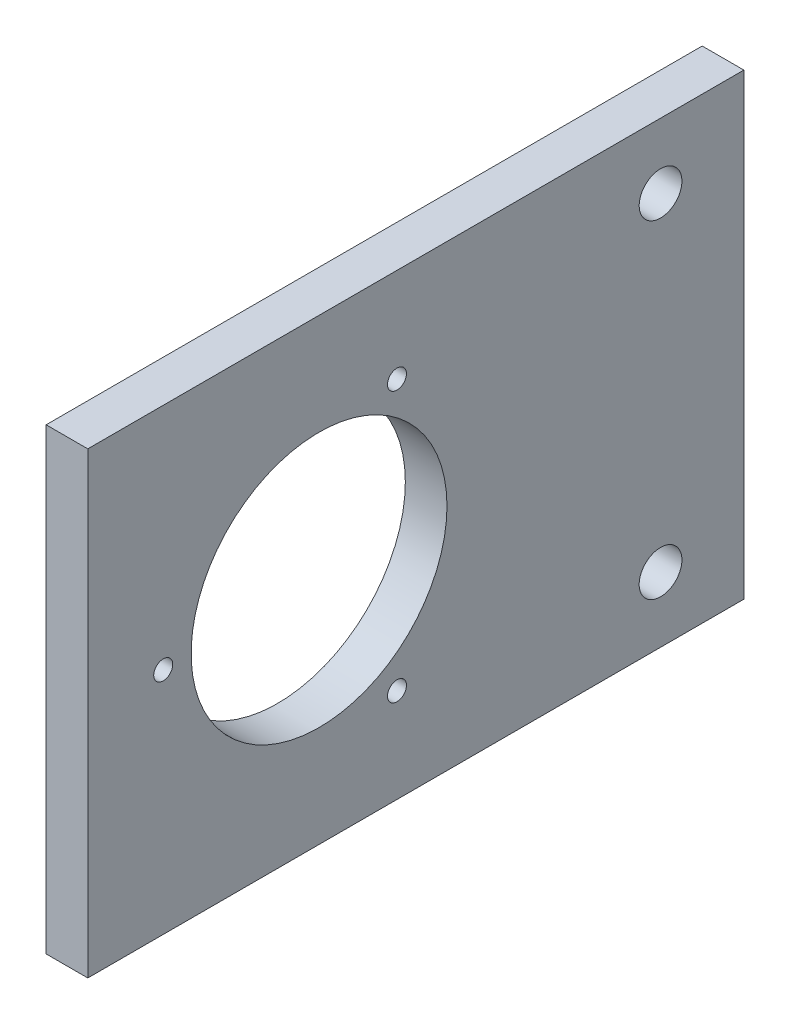
from build123d import *

# Parameters (mm, degrees)
SKETCH1_W           = 69.85
SKETCH1_H           = 100
SKETCH1_R           = 19.5
SKETCH1_R_2         = 3.25755
SKETCH1_R_3         = 1.45
BOSS_EXTRUDE1_DEPTH = 6.35


with BuildPart() as part:
    # Sketch1 → Boss-Extrude1 (new body)
    with BuildSketch(Plane.YZ):
        Rectangle(SKETCH1_W, SKETCH1_H)
        with Locations((0, 14.75)):
            Circle(SKETCH1_R, mode=Mode.SUBTRACT)
        with Locations((-25, -37.3)):
            Circle(SKETCH1_R_2, mode=Mode.SUBTRACT)
        with Locations((25, -37.3)):
            Circle(SKETCH1_R_2, mode=Mode.SUBTRACT)
        with Locations((-20.56810334, 2.875)):
            Circle(SKETCH1_R_3, mode=Mode.SUBTRACT)
        with Locations((20.56810334, 2.875)):
            Circle(SKETCH1_R_3, mode=Mode.SUBTRACT)
        with Locations((0, 38.5)):
            Circle(SKETCH1_R_3, mode=Mode.SUBTRACT)
    extrude(amount=BOSS_EXTRUDE1_DEPTH)


solid = part.part
